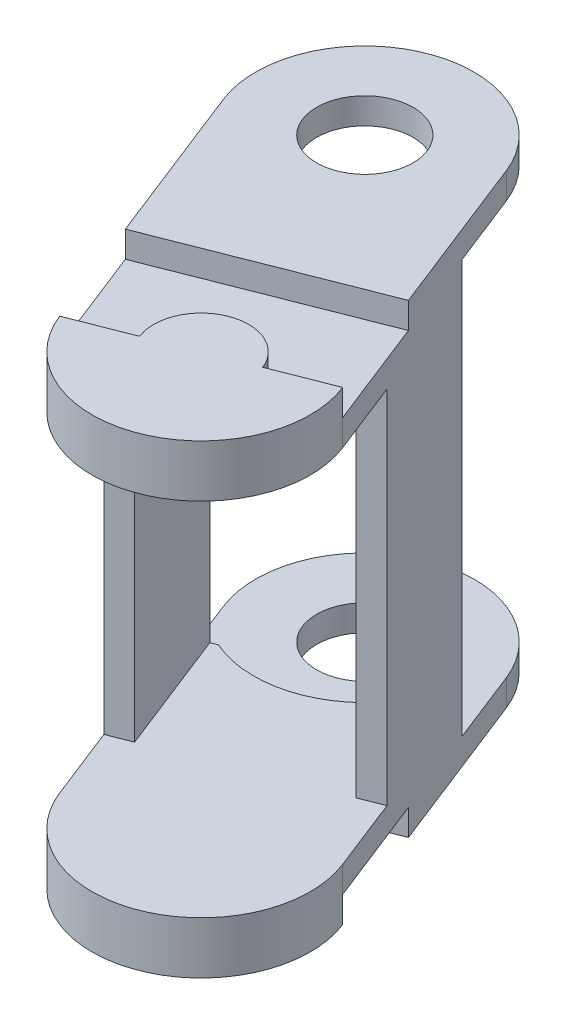
from build123d import *

# Parameters (mm, degrees)
SALIENTE_EXTRUIR1_START   = -2.75
SALIENTE_EXTRUIR1_DEPTH   = 5.5
SALIENTE_EXTRUIR1_2_DEPTH = 2.75
SALIENTE_EXTRUIR2_DEPTH   = 38
SALIENTE_EXTRUIR3_START   = 2.75
SALIENTE_EXTRUIR3_DEPTH   = 2.75
CROQUIS4_W                = 23
CROQUIS4_H                = 43.5
CORTAR_EXTRUIR1_DEPTH     = 8.25
CORTAR_EXTRUIR2_DEPTH     = 2.75
CROQUIS6_W                = 38
CROQUIS6_H                = 22.249999999
CORTAR_EXTRUIR3_DEPTH     = 16.59246817
CROQUIS7_W                = 3.203765914
CROQUIS7_H                = 38
CORTAR_EXTRUIR4_DEPTH     = 8.25
CROQUIS8_W                = 3.203765916
CROQUIS8_H                = 38
CORTAR_EXTRUIR5_DEPTH     = 8.25
CROQUIS9_W                = 14
CROQUIS9_H                = 38
CORTAR_EXTRUIR6_DEPTH     = 0.703765915
CROQUIS10_W               = 14
CROQUIS10_H               = 38
CORTAR_EXTRUIR7_DEPTH     = 0.703765915
SALIENTE_EXTRUIR4_START   = 2.75
SALIENTE_EXTRUIR4_DEPTH   = 2.75
CORTAR_EXTRUIR8_DEPTH     = 2.75
CROQUIS13_W               = 12.249999999
CROQUIS13_H               = 2.75
CORTAR_EXTRUIR9_DEPTH     = 74.034358614
CROQUIS14_W               = 12.249999999
CROQUIS14_H               = 2.75
CORTAR_EXTRUIR10_DEPTH    = 74.034358614
CROQUIS15_W               = 5
CROQUIS15_H               = 2.75
CROQUIS16_W               = 5
CROQUIS16_H               = 2.75
TALADRO1_D                = 10.15
TALADRO1_DEPTH            = 2.75
TALADRO2_D                = 10.15


with BuildPart() as part:
    # Saliente-Extruir1: read off the stored shape, not the designer's step
    # Saliente-Extruir1 outline → Saliente-Extruir1 (new body)
    with BuildSketch(Plane(origin=(0, 40.75, 0), x_dir=(-1, 0, 0), z_dir=(0, 1, 0)).offset(SALIENTE_EXTRUIR1_START)):
        with BuildLine():
            Line((161.177139208, 19.345694485), (182.584423689, 27.755698719))
            Line((182.584423689, 27.755698719), (171.432026769, 56.143619441))
            ThreePointArc((171.432026769, 56.143619441), (156.523382412, 62.642259564), (150.024742289, 47.733615207))
            Line((150.024742289, 47.733615207), (161.177139208, 19.345694485))
        make_face()
    extrude(amount=SALIENTE_EXTRUIR1_DEPTH)

    # Saliente-Extruir1 2 outline → Saliente-Extruir1 2 (add)
    with BuildSketch(Plane(origin=(0, 40.75, 0), x_dir=(-1, 0, 0), z_dir=(0, 1, 0))):
        with BuildLine():
            ThreePointArc((161.177139208, 19.345694485), (176.085783565, 12.847054362), (182.584423687, 27.755698719))
            Line((182.584423687, 27.755698719), (161.177139208, 19.345694485))
        make_face()
    extrude(amount=SALIENTE_EXTRUIR1_2_DEPTH)

    # Croquis2 → Saliente-Extruir2 (add)
    with BuildSketch(Plane.XZ.offset(-38)):
        Polygon((-171.432026768, 56.143619442), (-150.024742288, 47.733615205), (-161.177139209, 19.345694483), (-182.584423689, 27.755698719), align=None)
    extrude(amount=SALIENTE_EXTRUIR2_DEPTH)

    # Croquis3 → Saliente-Extruir3 (add)
    with BuildSketch(Plane.XZ.offset(SALIENTE_EXTRUIR3_START)):
        with BuildLine():
            Line((-182.584423688, 27.755698719), (-171.432026768, 56.143619441))
            ThreePointArc((-171.432026768, 56.143619441), (-156.523382412, 62.642259564), (-150.024742289, 47.733615207))
            Line((-150.024742289, 47.733615207), (-161.177139208, 19.345694485))
            Line((-161.177139208, 19.345694485), (-182.584423688, 27.755698719))
        make_face()
    extrude(amount=-SALIENTE_EXTRUIR3_DEPTH)

    # Croquis4 → Cortar-Extruir1 (cut)
    with BuildSketch(Plane(origin=(-14.965700114, 0, -38.094511116), x_dir=(-0.9307514991056489, 0, 0.3656523580022251), z_dir=(-0.3656523580022251, 0, -0.9307514991056489))):
        with Locations((168.589662745, 19)):
            Rectangle(CROQUIS4_W, CROQUIS4_H)
    extrude(amount=-CORTAR_EXTRUIR1_DEPTH, mode=Mode.SUBTRACT)

    # Croquis5 → Cortar-Extruir2 (cut)
    with BuildSketch(Plane(origin=(0, 40.75, 0), x_dir=(1, 0, 0), z_dir=(0, 1, 0))):
        with BuildLine():
            Line((-161.142417183, -28.195858914), (-176.585881806, -34.262934025))
            ThreePointArc((-176.585881806, -34.262934025), (-167.602648859, -34.440489141), (-161.142417183, -28.195858914))
        make_face()
    extrude(amount=-CORTAR_EXTRUIR2_DEPTH, mode=Mode.SUBTRACT)

    # Croquis6 → Cortar-Extruir3 (cut)
    with BuildSketch(Plane(origin=(-149.193349022, 0, 58.611670162), x_dir=(0, 1, 0), z_dir=(0.9307514991056486, 0, -0.3656523580022258))):
        with Locations((19, -21.553766865)):
            Rectangle(CROQUIS6_W, CROQUIS6_H)
    extrude(amount=-CORTAR_EXTRUIR3_DEPTH, mode=Mode.SUBTRACT)

    # Croquis7 → Cortar-Extruir4 (cut)
    with BuildSketch(Plane(origin=(-3.8133032, 0, -9.706590403), x_dir=(0.9307514990825102, 0, -0.36565235806112356), z_dir=(0.36565235806112356, 0, 0.9307514990825102))):
        with Locations((-158.691545702, 19)):
            Rectangle(CROQUIS7_W, CROQUIS7_H)
    extrude(amount=-CORTAR_EXTRUIR4_DEPTH, mode=Mode.SUBTRACT)

    # Croquis8 → Cortar-Extruir5 (cut)
    with BuildSketch(Plane(origin=(-3.8133032, 0, -9.706590403), x_dir=(0.9307514990825102, 0, -0.36565235806112356), z_dir=(0.36565235806112356, 0, 0.9307514990825102))):
        with Locations((-178.487779787, 19)):
            Rectangle(CROQUIS8_W, CROQUIS8_H)
    extrude(amount=-CORTAR_EXTRUIR5_DEPTH, mode=Mode.SUBTRACT)

    # Croquis9 → Cortar-Extruir6 (cut)
    with BuildSketch(Plane(origin=(-164.636813645, 0, 64.678745273), x_dir=(-0.3656523580022247, 0, -0.930751499105649), z_dir=(0.930751499105649, 1.4355340193330324e-15, -0.3656523580022247))):
        with Locations((25.678766864, 19)):
            Rectangle(CROQUIS9_W, CROQUIS9_H)
    extrude(amount=-CORTAR_EXTRUIR6_DEPTH, mode=Mode.SUBTRACT)

    # Croquis10 → Cortar-Extruir7 (cut)
    with BuildSketch(Plane(origin=(-149.193349022, 0, 58.611670162), x_dir=(0.3656523580022248, 0, 0.930751499105649), z_dir=(-0.930751499105649, -1.4355340193330322e-15, 0.3656523580022248))):
        with Locations((-25.678766864, 19)):
            Rectangle(CROQUIS10_W, CROQUIS10_H)
    extrude(amount=-CORTAR_EXTRUIR7_DEPTH, mode=Mode.SUBTRACT)

    # Croquis11 → Saliente-Extruir4 (add)
    with BuildSketch(Plane.XZ.offset(2.75).offset(SALIENTE_EXTRUIR4_START)):
        with BuildLine():
            Line((-150.024742289, 47.733615207), (-161.177139208, 19.345694485))
            ThreePointArc((-161.177139208, 19.345694485), (-176.085783565, 12.847054362), (-182.584423687, 27.755698719))
            Line((-182.584423687, 27.755698719), (-171.432026769, 56.143619441))
            ThreePointArc((-171.432026769, 56.143619441), (-156.523382412, 62.642259564), (-150.024742289, 47.733615207))
        make_face()
    extrude(amount=-SALIENTE_EXTRUIR4_DEPTH)

    # Croquis12 → Cortar-Extruir8 (cut)
    with BuildSketch(Plane(origin=(0, 0, 0), x_dir=(-1, 0, 0), z_dir=(0, 1, 0))):
        with BuildLine():
            Line((161.142417183, 28.195858914), (176.585881806, 34.262934025))
            ThreePointArc((176.585881806, 34.262934025), (167.602648859, 34.440489141), (161.142417183, 28.195858914))
        make_face()
    extrude(amount=-CORTAR_EXTRUIR8_DEPTH, mode=Mode.SUBTRACT)

    # Croquis13 → Cortar-Extruir9 (cut, through all)
    with BuildSketch(Plane(origin=(-146.211439094, 0, 57.440205601), x_dir=(-0.36565235800222584, 0, -0.9307514991056486), z_dir=(0.9307514991056486, 0, -0.36565235800222584))):
        with Locations((16.553766864, -4.125)):
            Rectangle(CROQUIS13_W, CROQUIS13_H)
    extrude(amount=-CORTAR_EXTRUIR9_DEPTH, mode=Mode.SUBTRACT)

    # Croquis14 → Cortar-Extruir10 (cut, through all)
    with BuildSketch(Plane(origin=(-146.211439094, 0, 57.440205601), x_dir=(-0.36565235800222584, 0, -0.9307514991056486), z_dir=(0.9307514991056486, 0, -0.36565235800222584))):
        with Locations((16.553766864, 42.125)):
            Rectangle(CROQUIS14_W, CROQUIS14_H)
    extrude(amount=-CORTAR_EXTRUIR10_DEPTH, mode=Mode.SUBTRACT)

    # Croquis15 → Revolución1 (revolve)
    with BuildSketch(Plane(origin=(0, 0, 51.938617325), x_dir=(-1, 0, 0), z_dir=(0, 0, -1))):
        with Locations((158.228384529, -4.125)):
            Rectangle(CROQUIS15_W, CROQUIS15_H)
    revolve(axis=Axis((-160.728384529, -5.5, 51.938617325), (0, 1, 0)))

    # Croquis16 → Revolución2 (revolve)
    with BuildSketch(Plane(origin=(0, 0, 51.938617325), x_dir=(-1, 0, 0), z_dir=(0, 0, -1))):
        with Locations((158.228384529, 42.125)):
            Rectangle(CROQUIS16_W, CROQUIS16_H)
    revolve(axis=Axis((-160.728384529, 40.75, 51.938617325), (0, 1, 0)))

    # Taladro1
    with Locations(Plane(origin=(0, -5.5, 0), x_dir=(-1, 0, 0), z_dir=(0, -1, 0))):
        with Locations((171.880781448, -23.550696602)):
            Hole(TALADRO1_D / 2, depth=TALADRO1_DEPTH)

    # Taladro2 (through all)
    with Locations(Plane(origin=(0, 40.75, 0), x_dir=(-1, 0, 0), z_dir=(0, -1, 0))):
        with Locations((171.880781448, -23.550696602)):
            Hole(TALADRO2_D / 2)


solid = part.part
